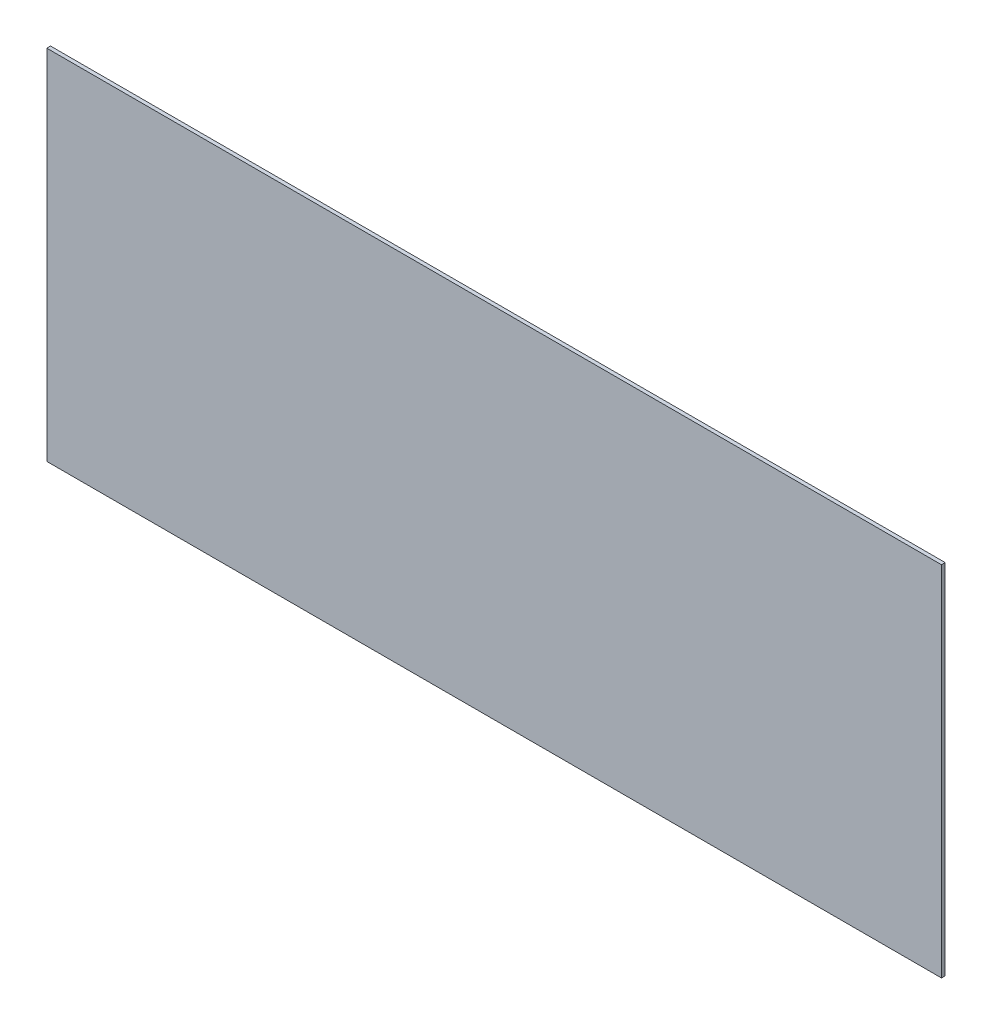
from build123d import *

# Parameters (mm, degrees)
SKETCH1_W           = 762
SKETCH1_H           = 304.8
BOSS_EXTRUDE1_DEPTH = 3.175


with BuildPart() as part:
    # Sketch1 → Boss-Extrude1 (new body)
    with BuildSketch(Plane.XY):
        with Locations((142.146174142, 118.622691293)):
            Rectangle(SKETCH1_W, SKETCH1_H)
    extrude(amount=BOSS_EXTRUDE1_DEPTH)


solid = part.part
